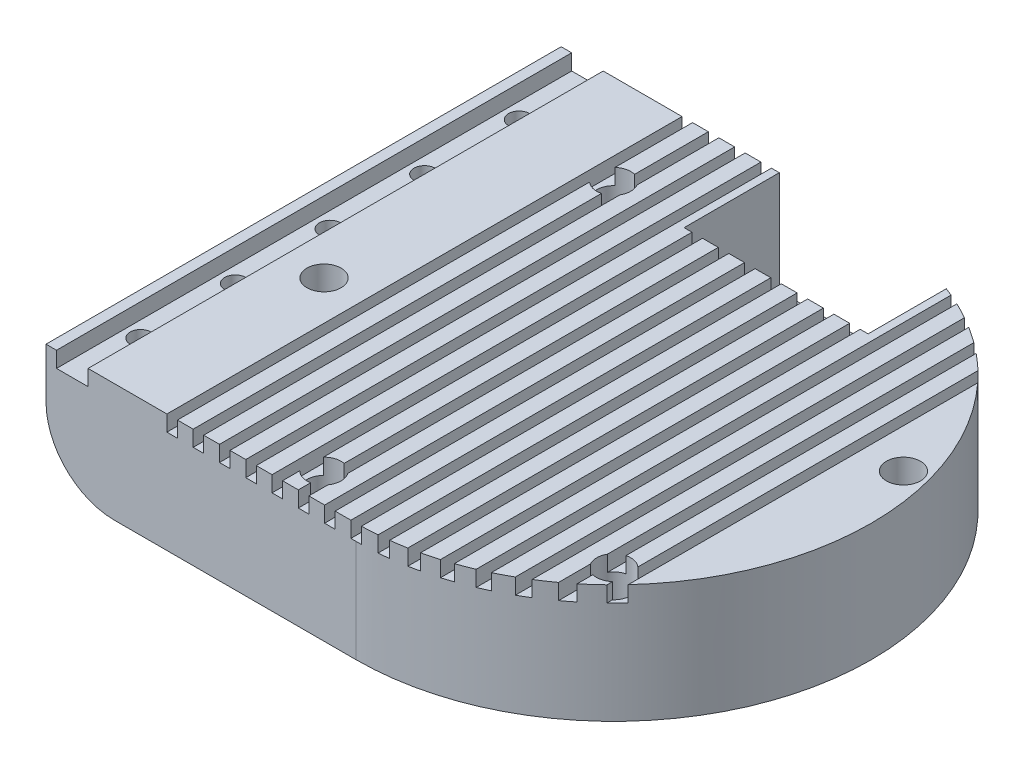
from build123d import *

# Parameters (mm, degrees)
SKETCH_1_R           = 2
SKETCH_1_R_2         = 35.5
EXTRUDE_4_DEPTH      = 22.5
EXTRUDE_START        = 12.5
SKETCH_1_6_R         = 35.5
EXTRUDE_5_DEPTH      = 10
SKETCH_10_W          = 6
SKETCH_10_H          = 98
CUT_EXTRUDE_8_DEPTH  = 3
SKETCH_11_R          = 3.25
CUT_EXTRUDE_9_DEPTH  = 17.5
CUT_EXTRUDE_START    = -3
SKETCH_12_W          = 35
SKETCH_12_H          = 18.113109577
CUT_EXTRUDE_10_DEPTH = 30
SKETCH_13_R          = 2
CUT_EXTRUDE_11_DEPTH = 30
SKETCH_14_R          = 3.25
CUT_EXTRUDE_12_DEPTH = 17.5
SKETCH_15_W          = 2
SKETCH_15_H          = 6
CUT_EXTRUDE_13_DEPTH = 150
FILLET_START         = -50
FILLET_2_DEPTH       = 100
CUT_EXTRUDE_16_DEPTH = 18


with BuildPart() as part:
    # 스케치1 → 보스-돌출4 (new body)
    with BuildSketch(Plane(origin=(0, 0, 0), x_dir=(1, 0, 0), z_dir=(0, 1, 0))):
        with BuildLine():
            Line((-59, 49), (-59, -49))
            Line((-59, -49), (0, -49))
            ThreePointArc((0, -49), (49, 0), (0, 49))
            Line((0, 49), (-59, 49))
        make_face()
        with Locations(Location((31.819805153, -31.819805153, 0), (0, 0, 90))):
            Circle(SKETCH_1_R, mode=Mode.SUBTRACT)
        with Locations(Location((-11.64685703, -43.466662183, 0), (0, 0, 90))):
            Circle(SKETCH_1_R, mode=Mode.SUBTRACT)
        with Locations(Location((-43.466662183, -11.64685703, 0), (0, 0, 90))):
            Circle(SKETCH_1_R, mode=Mode.SUBTRACT)
        with Locations(Location((-31.819805153, 31.819805153, 0), (0, 0, 90))):
            Circle(SKETCH_1_R, mode=Mode.SUBTRACT)
        with Locations(Location((11.64685703, 43.466662183, 0), (0, 0, 90))):
            Circle(SKETCH_1_R, mode=Mode.SUBTRACT)
        with Locations(Location((43.466662183, 11.64685703, 0), (0, 0, 90))):
            Circle(SKETCH_1_R, mode=Mode.SUBTRACT)
        with Locations(Location((0, 0, 0), (0, 0, 90))):
            Circle(SKETCH_1_R_2, mode=Mode.SUBTRACT)
    extrude(amount=EXTRUDE_4_DEPTH)

    # 스케치1<6> → 보스-돌출5 (add)
    with BuildSketch(Plane(origin=(0, 0, 0), x_dir=(1, 0, 0), z_dir=(0, 1, 0)).offset(EXTRUDE_START)):
        with Locations(Location((0, 0, 0), (0, 0, 90))):
            Circle(SKETCH_1_6_R)
    extrude(amount=EXTRUDE_5_DEPTH)

    # 스케치10 → 컷-돌출8 (cut)
    with BuildSketch(Plane(origin=(0, 22.5, 0), x_dir=(1, 0, 0), z_dir=(0, 1, 0))):
        with Locations((-54, 0)):
            Rectangle(SKETCH_10_W, SKETCH_10_H)
    extrude(amount=-CUT_EXTRUDE_8_DEPTH, mode=Mode.SUBTRACT)

    # 스케치11 → 컷-돌출9 (cut)
    with BuildSketch(Plane(origin=(0, 22.5, 0), x_dir=(1, 0, 0), z_dir=(0, 1, 0))):
        with Locations(Location((-31.819805153, 31.819805153, 0), (0, 0, 270))):
            Circle(SKETCH_11_R)
        with Locations(Location((11.64685703, 43.466662183, 0), (0, 0, 270))):
            Circle(SKETCH_11_R)
        with Locations(Location((43.466662183, 11.64685703, 0), (0, 0, 270))):
            Circle(SKETCH_11_R)
        with Locations(Location((31.819805153, -31.819805153, 0), (0, 0, 270))):
            Circle(SKETCH_11_R)
        with Locations(Location((-11.64685703, -43.466662183, 0), (0, 0, 270))):
            Circle(SKETCH_11_R)
        with Locations(Location((-43.466662183, -11.64685703, 0), (0, 0, 270))):
            Circle(SKETCH_11_R)
    extrude(amount=-CUT_EXTRUDE_9_DEPTH, mode=Mode.SUBTRACT)

    # 스케치12 → 컷-돌출10 (cut)
    with BuildSketch(Plane.XZ.offset(CUT_EXTRUDE_START)):
        with Locations((0, -39.943445211)):
            Rectangle(SKETCH_12_W, SKETCH_12_H)
    extrude(amount=-CUT_EXTRUDE_10_DEPTH, mode=Mode.SUBTRACT)

    # 스케치13 → 컷-돌출11 (cut)
    with BuildSketch(Plane(origin=(0, 19.5, 0), x_dir=(1, 0, 0), z_dir=(0, 1, 0))):
        with Locations(Location((-54, 36, 0), (0, 0, 270))):
            Circle(SKETCH_13_R)
        with Locations(Location((-54, 18, 0), (0, 0, 270))):
            Circle(SKETCH_13_R)
        with Locations(Location((-54, 0, 0), (0, 0, 270))):
            Circle(SKETCH_13_R)
        with Locations(Location((-54, -18, 0), (0, 0, 270))):
            Circle(SKETCH_13_R)
        with Locations(Location((-54, -36, 0), (0, 0, 270))):
            Circle(SKETCH_13_R)
    extrude(amount=-CUT_EXTRUDE_11_DEPTH, mode=Mode.SUBTRACT)

    # 스케치14 → 컷-돌출12 (cut)
    with BuildSketch(Plane.XZ):
        with Locations(Location((-54, 36, 0), (0, 0, 270))):
            Circle(SKETCH_14_R)
        with Locations(Location((-54, 18, 0), (0, 0, 270))):
            Circle(SKETCH_14_R)
        with Locations(Location((-54, 0, 0), (0, 0, 270))):
            Circle(SKETCH_14_R)
        with Locations(Location((-54, -18, 0), (0, 0, 270))):
            Circle(SKETCH_14_R)
        with Locations(Location((-54, -36, 0), (0, 0, 270))):
            Circle(SKETCH_14_R)
    extrude(amount=-CUT_EXTRUDE_12_DEPTH, mode=Mode.SUBTRACT)

    # 스케치15 → 컷-돌출13 (cut, symmetric)
    with BuildSketch(Plane.XY):
        with Locations((0, 22.5)):
            Rectangle(SKETCH_15_W, SKETCH_15_H)
        with Locations((5, 22.5)):
            Rectangle(SKETCH_15_W, SKETCH_15_H)
        with Locations((10, 22.5)):
            Rectangle(SKETCH_15_W, SKETCH_15_H)
        with Locations((15, 22.5)):
            Rectangle(SKETCH_15_W, SKETCH_15_H)
        with Locations((20, 22.5)):
            Rectangle(SKETCH_15_W, SKETCH_15_H)
        with Locations((25, 22.5)):
            Rectangle(SKETCH_15_W, SKETCH_15_H)
        with Locations((30, 22.5)):
            Rectangle(SKETCH_15_W, SKETCH_15_H)
        with Locations((35, 22.5)):
            Rectangle(SKETCH_15_W, SKETCH_15_H)
        with Locations((-5, 22.5)):
            Rectangle(SKETCH_15_W, SKETCH_15_H)
        with Locations((-10, 22.5)):
            Rectangle(SKETCH_15_W, SKETCH_15_H)
        with Locations((-15, 22.5)):
            Rectangle(SKETCH_15_W, SKETCH_15_H)
        with Locations((-20, 22.5)):
            Rectangle(SKETCH_15_W, SKETCH_15_H)
        with Locations((-25, 22.5)):
            Rectangle(SKETCH_15_W, SKETCH_15_H)
        with Locations((-30, 22.5)):
            Rectangle(SKETCH_15_W, SKETCH_15_H)
        with Locations((-35, 22.5)):
            Rectangle(SKETCH_15_W, SKETCH_15_H)
    extrude(amount=CUT_EXTRUDE_13_DEPTH, both=True, mode=Mode.SUBTRACT)

    # 필렛2: read off the stored shape, not the designer's step
    # 필렛2 outline → 필렛2 (cut)
    with BuildSketch(Plane.XY.offset(FILLET_START)):
        with BuildLine():
            ThreePointArc((-46, 0), (-55.192388155, 3.807611845), (-59, 13))
            Line((-59, 13), (-59, 0))
            Line((-59, 0), (-46, 0))
        make_face()
    extrude(amount=FILLET_2_DEPTH, mode=Mode.SUBTRACT)

    # 스케치17 → 컷-돌출16 (cut)
    with BuildSketch(Plane.XZ):
        with BuildLine():
            ThreePointArc((-17.02464374, 33.412744657), (-14.948817624, 39.801480521), (-21.337553488, 41.877306637))
            ThreePointArc((-21.337553488, 41.877306637), (-33.234018716, 33.234018716), (-41.877306637, 21.337553488))
            ThreePointArc((-41.877306637, 21.337553488), (-39.801480521, 14.948817624), (-33.412744657, 17.02464374))
            ThreePointArc((-33.412744657, 17.02464374), (-26.516504294, 26.516504294), (-17.02464374, 33.412744657))
        make_face()
        with BuildLine():
            ThreePointArc((-46, -9.643650761), (-43.447366213, -17.925578629), (-39.417516693, -25.598034646))
            ThreePointArc((-39.417516693, -25.598034646), (-32.846796079, -26.994684427), (-31.450146298, -20.423963813))
            ThreePointArc((-31.450146298, -20.423963813), (-36.222218486, -9.705714191), (-37.448607553, 1.962598359))
            ThreePointArc((-37.448607553, 1.962598359), (-40.578774526, 6.6788208), (-46, 5.050627399))
            Line((-46, 5.050627399), (-46, -9.643650761))
        make_face()
        with BuildLine():
            ThreePointArc((20.423963813, 31.450146298), (9.705714191, 36.222218486), (-1.962598359, 37.448607553))
            ThreePointArc((-1.962598359, 37.448607553), (-6.954684441, 41.943502051), (-2.459789943, 46.935588133))
            ThreePointArc((-2.459789943, 46.935588133), (12.16449512, 45.398513836), (25.598034646, 39.417516693))
            ThreePointArc((25.598034646, 39.417516693), (26.994684427, 32.846796079), (20.423963813, 31.450146298))
        make_face()
        with BuildLine():
            ThreePointArc((37.448607553, -1.962598359), (36.222218486, 9.705714191), (31.450146298, 20.423963813))
            ThreePointArc((31.450146298, 20.423963813), (32.846796079, 26.994684427), (39.417516693, 25.598034646))
            ThreePointArc((39.417516693, 25.598034646), (45.398513836, 12.16449512), (46.935588133, -2.459789943))
            ThreePointArc((46.935588133, -2.459789943), (41.943502051, -6.954684441), (37.448607553, -1.962598359))
        make_face()
        with BuildLine():
            ThreePointArc((21.509116363, -30.718201661), (28.301609258, -24.602213587), (33.412744657, -17.02464374))
            ThreePointArc((33.412744657, -17.02464374), (39.801480521, -14.948817624), (41.877306637, -21.337553488))
            ThreePointArc((41.877306637, -21.337553488), (35.47135027, -30.834774363), (26.958092508, -38.500146082))
            ThreePointArc((26.958092508, -38.500146082), (20.342632225, -37.333661944), (21.509116363, -30.718201661))
        make_face()
    extrude(amount=-CUT_EXTRUDE_16_DEPTH, mode=Mode.SUBTRACT)


solid = part.part
